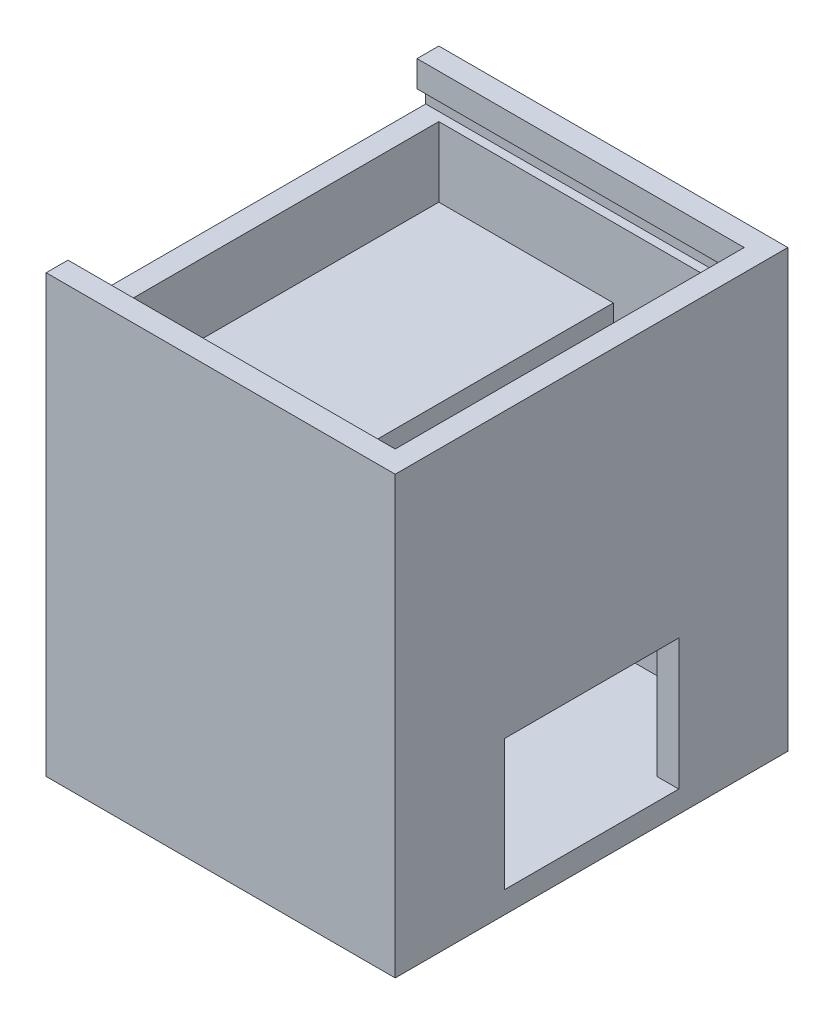
from build123d import *

# Parameters (mm, degrees)
SKETCH1_W           = 40
SKETCH1_H           = 45
BOSS_EXTRUDE1_DEPTH = 50
SHELL1_T            = -2.5
SKETCH3_W           = 40
SKETCH3_H           = 34.5
BOSS_EXTRUDE2_DEPTH = 20
SKETCH8_W           = 20
SKETCH8_H           = 15
CUT_EXTRUDE1_DEPTH  = 2.5
SKETCH11_W          = 40
SKETCH11_H          = 5
CUT_EXTRUDE2_DEPTH  = 2.5
SKETCH12_W          = 37.5
SKETCH12_H          = 2
CUT_EXTRUDE3_DEPTH  = 1
SKETCH13_W          = 37.5
SKETCH13_H          = 2
CUT_EXTRUDE4_DEPTH  = 1


with BuildPart() as part:
    # Sketch1 → Boss-Extrude1 (new body)
    with BuildSketch(Plane(origin=(0, 0, 0), x_dir=(1, 0, 0), z_dir=(0, 1, 0))):
        with Locations((-14.888700463, -8.449653636)):
            Rectangle(SKETCH1_W, SKETCH1_H)
    extrude(amount=BOSS_EXTRUDE1_DEPTH)

    # Shell1
    shell1_openings = [part.faces().sort_by_distance(p)[0] for p in [
        (-14.888700463, 50, 8.449653636),
    ]]
    offset(amount=SHELL1_T, openings=shell1_openings, kind=Kind.INTERSECTION)

    # Sketch3 → Boss-Extrude2 (add)
    with BuildSketch(Plane(origin=(-32.388700463, 0, 0), x_dir=(0, 0, -1), z_dir=(1, 0, 0))):
        with Locations((-8.449653636, 19.75)):
            Rectangle(SKETCH3_W, SKETCH3_H)
    extrude(amount=BOSS_EXTRUDE2_DEPTH)

    # Sketch8 → Cut-Extrude1 (cut)
    with BuildSketch(Plane.ZY.offset(-2.611299537)):
        with Locations((8.449653636, 10)):
            Rectangle(SKETCH8_W, SKETCH8_H)
    extrude(amount=-CUT_EXTRUDE1_DEPTH, mode=Mode.SUBTRACT)

    # Sketch11 → Cut-Extrude2 (cut)
    with BuildSketch(Plane(origin=(-32.388700463, 0, 0), x_dir=(0, 0, -1), z_dir=(1, 0, 0))):
        with Locations((-8.449653636, 47.5)):
            Rectangle(SKETCH11_W, SKETCH11_H)
    extrude(amount=-CUT_EXTRUDE2_DEPTH, mode=Mode.SUBTRACT)

    # Sketch12 → Cut-Extrude3 (cut)
    with BuildSketch(Plane.XY.offset(-11.550346364)):
        with Locations((-16.138700463, 46)):
            Rectangle(SKETCH12_W, SKETCH12_H)
    extrude(amount=-CUT_EXTRUDE3_DEPTH, mode=Mode.SUBTRACT)

    # Sketch13 → Cut-Extrude4 (cut)
    with BuildSketch(Plane(origin=(0, 0, 28.449653636), x_dir=(-1, 0, 0), z_dir=(0, 0, -1))):
        with Locations((16.138700463, 46)):
            Rectangle(SKETCH13_W, SKETCH13_H)
    extrude(amount=-CUT_EXTRUDE4_DEPTH, mode=Mode.SUBTRACT)


solid = part.part
